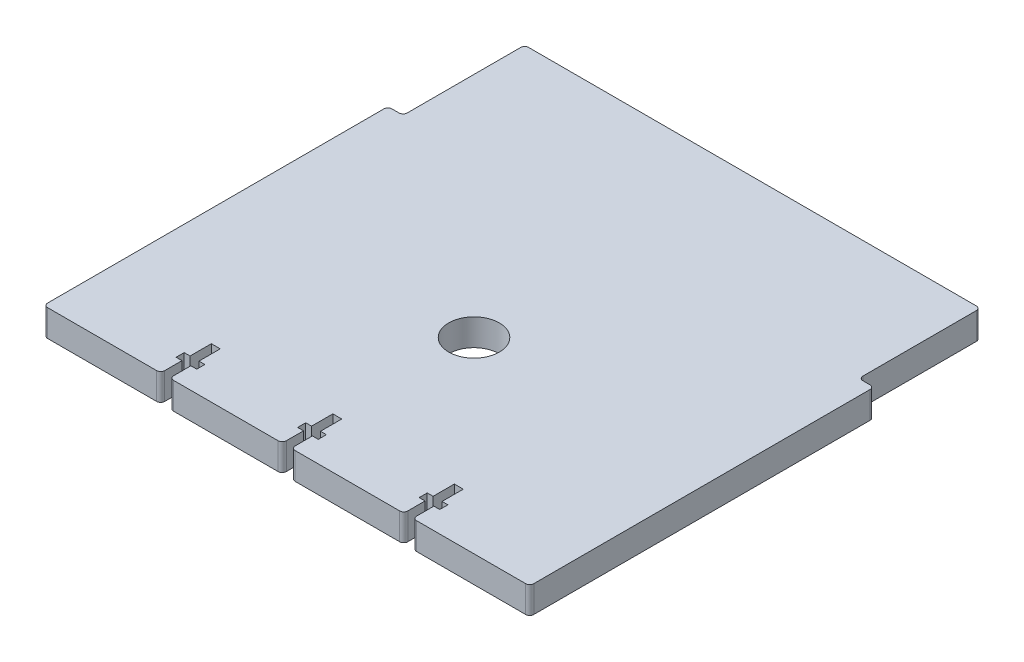
from build123d import *

# Parameters (mm, degrees)
BOSS_EXTRUDE1_DEPTH          = 8.382
CUT_EXTRUDE2_DEPTH           = 208.840544241
F_5_8_0_625_DIAMETER_HOLE1_D = 15.875
FILLET1_R                    = 1.27


with BuildPart() as part:
    # Sketch1 → Boss-Extrude1 (new body)
    with BuildSketch(Plane(origin=(0, 0, 0), x_dir=(1, 0, 0), z_dir=(0, 1, 0))):
        Polygon((0, 0), (142.875, 0), (147.6375, 0), (147.6375, 107.95), (142.875, 107.95), (142.875, 146.05), (0, 146.05), (0, 107.95), (-4.7625, 107.95), (-4.7625, 0), align=None)
    extrude(amount=BOSS_EXTRUDE1_DEPTH)

    # Sketch10 → Cut-Extrude2 (cut, through all)
    with BuildSketch(Plane(origin=(0, 8.382, 0), x_dir=(1, 0, 0), z_dir=(0, 1, 0))):
        Polygon((70.0405, 9.2075), (68.199, 9.2075), (68.199, 6.6675), (70.0405, 6.6675), (70.0405, 0), (72.8345, 0), (72.8345, 6.6675), (74.676, 6.6675), (74.676, 9.2075), (72.8345, 9.2075), (72.8345, 15.875), (70.0405, 15.875), align=None)
        Polygon((108.1405, 15.875), (110.9345, 15.875), (110.9345, 9.2075), (112.776, 9.2075), (112.776, 6.6675), (110.9345, 6.6675), (110.9345, 0), (108.1405, 0), (108.1405, 6.6675), (106.299, 6.6675), (106.299, 9.2075), (108.1405, 9.2075), align=None)
        Polygon((34.7345, 15.875), (34.7345, 9.2075), (36.576, 9.2075), (36.576, 6.6675), (34.7345, 6.6675), (34.7345, 0), (31.9405, 0), (31.9405, 6.6675), (30.099, 6.6675), (30.099, 9.2075), (31.9405, 9.2075), (31.9405, 15.875), align=None)
    extrude(amount=-CUT_EXTRUDE2_DEPTH, mode=Mode.SUBTRACT)

    # 5/8 (0.625) Diameter Hole1 (through all)
    with Locations(Plane(origin=(0, 0, 0), x_dir=(-1, 0, 0), z_dir=(0, -1, 0))):
        with Locations((-71.4375, 58.7375)):
            Hole(F_5_8_0_625_DIAMETER_HOLE1_D / 2)

    # Fillet1
    fillet1_edges = [part.edges().sort_by_distance(p)[0] for p in [
        (72.8345, 4.191, 0),
        (70.0405, 4.191, 0),
        (147.6375, 4.191, -107.95),
        (142.875, 4.191, -107.95),
        (142.875, 4.191, -146.05),
        (0, 4.191, -107.95),
        (0, 4.191, -146.05),
        (-4.7625, 4.191, -107.95),
        (-4.7625, 4.191, 0),
        (147.6375, 4.191, 0),
        (108.1405, 4.191, 0),
        (110.9345, 4.191, 0),
        (34.7345, 4.191, 0),
        (31.9405, 4.191, 0),
    ]]
    fillet(fillet1_edges, radius=FILLET1_R)


solid = part.part
